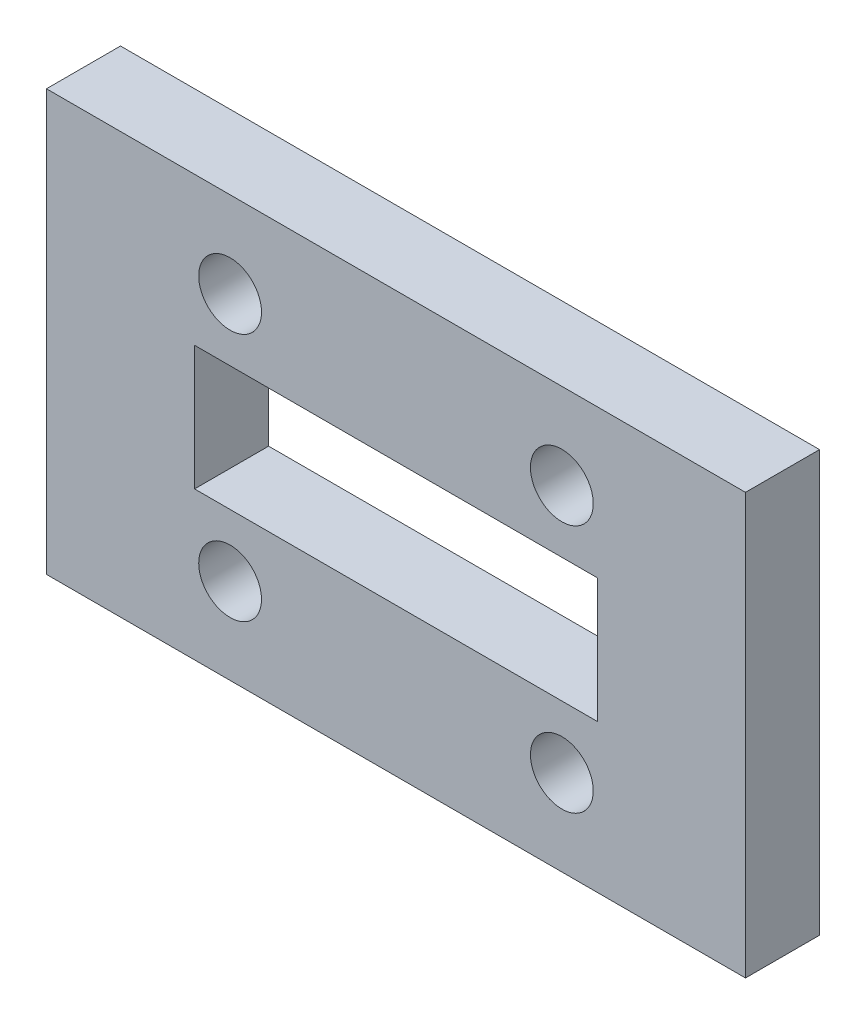
from build123d import *

# Parameters (mm, degrees)
SKETCH2_W           = 29.972
SKETCH2_H           = 18.034
SKETCH2_R           = 1.3462
SKETCH2_W_2         = 17.272
SKETCH2_H_2         = 5.334
BOSS_EXTRUDE1_DEPTH = 3.175


with BuildPart() as part:
    # Sketch2 → Boss-Extrude1 (new body)
    with BuildSketch(Plane.XY):
        Rectangle(SKETCH2_W, SKETCH2_H)
        with Locations((-7.112, 5.334)):
            Circle(SKETCH2_R, mode=Mode.SUBTRACT)
        with Locations((7.112, 5.334)):
            Circle(SKETCH2_R, mode=Mode.SUBTRACT)
        with Locations((7.112, -5.334)):
            Circle(SKETCH2_R, mode=Mode.SUBTRACT)
        with Locations((-7.112, -5.334)):
            Circle(SKETCH2_R, mode=Mode.SUBTRACT)
        Rectangle(SKETCH2_W_2, SKETCH2_H_2, mode=Mode.SUBTRACT)
    extrude(amount=BOSS_EXTRUDE1_DEPTH)


solid = part.part
